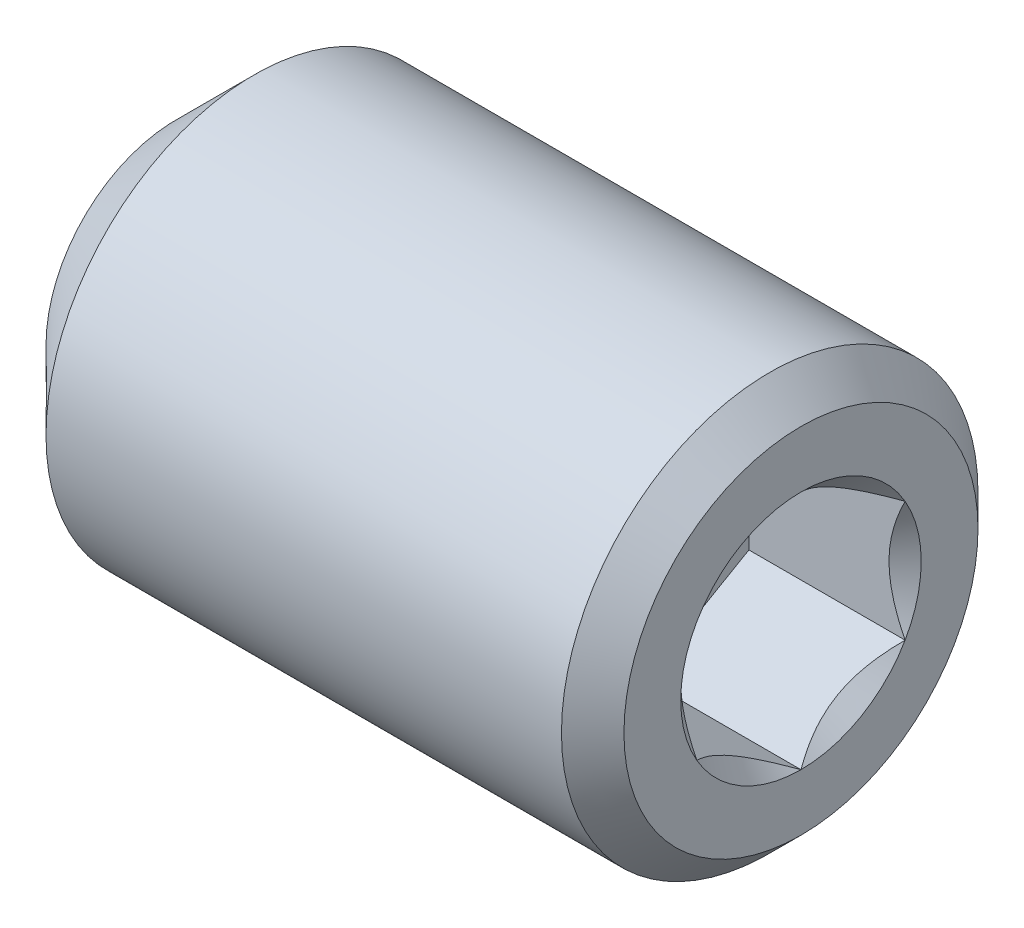
from build123d import *

# Parameters (mm, degrees)
SKETCH1_R           = 2
BOSS_EXTRUDE1_DEPTH = 6
CHAMFER1_SIZE       = 0.75
CHAMFER2_SIZE       = 0.3
CUT_EXTRUDE1_DEPTH  = 1.5
SKETCH3_R           = 1.154700538
CUT_EXTRUDE2_DEPTH  = 1
CUT_EXTRUDE2_DRAFT  = -45


with BuildPart() as part:
    # Sketch1 → Boss-Extrude1 (new body)
    with BuildSketch(Plane(origin=(0, 0, 0), x_dir=(0, 0, -1), z_dir=(1, 0, 0))):
        Circle(SKETCH1_R)
    extrude(amount=-BOSS_EXTRUDE1_DEPTH)

    # Chamfer1
    chamfer1_edges = [part.edges().sort_by_distance(p)[0] for p in [
        (-6, 0, 2),
    ]]
    chamfer(chamfer1_edges, length=CHAMFER1_SIZE)

    # Chamfer2
    chamfer2_edges = [part.edges().sort_by_distance(p)[0] for p in [
        (0, 0, 2),
    ]]
    chamfer(chamfer2_edges, length=CHAMFER2_SIZE)

    # Sketch2 → Cut-Extrude1 (cut)
    with BuildSketch(Plane(origin=(0, 0, 0), x_dir=(0, 0, -1), z_dir=(1, 0, 0))):
        Polygon((0, 1.154700538), (-1, 0.577350269), (-1, -0.577350269), (0, -1.154700538), (1, -0.577350269), (1, 0.577350269), align=None)
    extrude(amount=-CUT_EXTRUDE1_DEPTH, mode=Mode.SUBTRACT)


with BuildPart() as cut_extrude2_tool:
    # Sketch3 → Cut-Extrude2 (with draft: the straight prism first)
    with BuildSketch(Plane(origin=(0, 0, 0), x_dir=(0, 0, -1), z_dir=(1, 0, 0))):
        Circle(SKETCH3_R)
    extrude(amount=-CUT_EXTRUDE2_DEPTH)
    # Cut-Extrude2: the draft: its side faces are tilted about the plane it starts from
    cut_extrude2_sides = [cut_extrude2_tool.faces().sort_by_distance(p)[0] for p in [
        (-0.5, 0, 1.154700538),
    ]]
    draft(cut_extrude2_sides, Plane(origin=(0, 0, 0), x_dir=(0, 0, -1), z_dir=(1, 0, 0)), CUT_EXTRUDE2_DRAFT)


with BuildPart() as part_1:
    add(part.part)

    # Cut-Extrude2: cut by cut_extrude2_tool
    add(cut_extrude2_tool.part, mode=Mode.SUBTRACT)


solid = part_1.part
